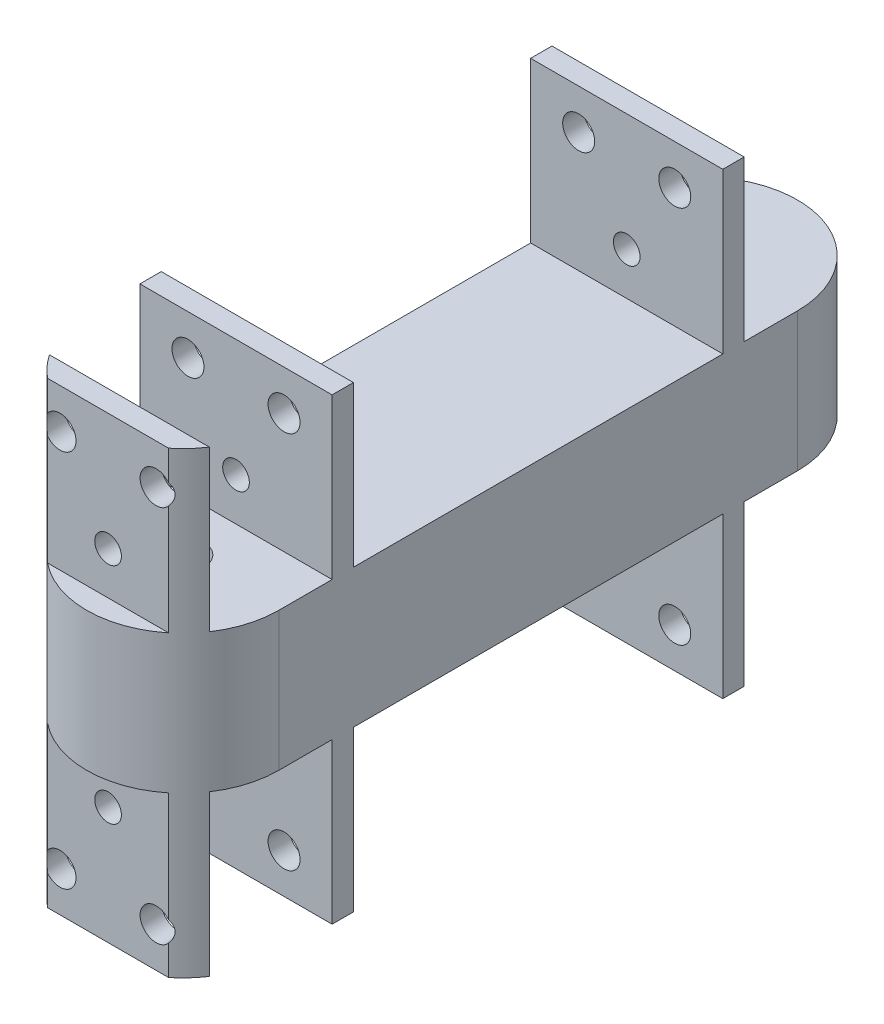
from build123d import *

# Parameters (mm, degrees)
SKETCH1_R                      = 4
BOSS_EXTRUDE1_DEPTH            = 3
BOSS_EXTRUDE3_DEPTH            = 20
BOSS_EXTRUDE4_START            = 30
SKETCH4_W                      = 36.05
SKETCH4_H                      = 4
BOSS_EXTRUDE4_DEPTH            = 30
CUT_EXTRUDE1_REACH             = 109.19
SKETCH5_R                      = 2.5
SKETCH5_R_2                    = 3
CUT_EXTRUDE1_DIRECTION_2_REACH = 109.19


with BuildPart() as part:
    # Sketch1 → Boss-Extrude1 (new body)
    with BuildSketch(Plane(origin=(0, 0, 0), x_dir=(1, 0, 0), z_dir=(0, 1, 0))):
        with BuildLine():
            Line((-18.025, 0), (-18.025, 97.29))
            ThreePointArc((-18.025, 97.29), (0, 115.315), (18.025, 97.29))
            Line((18.025, 97.29), (18.025, 0))
            ThreePointArc((18.025, 0), (0, -18.025), (-18.025, 0))
        make_face()
        Circle(SKETCH1_R, mode=Mode.SUBTRACT)
        with Locations((0, 97.29)):
            Circle(SKETCH1_R, mode=Mode.SUBTRACT)
    boss_extrude1 = extrude(amount=BOSS_EXTRUDE1_DEPTH)

    # Sketch3 → Boss-Extrude3 (add)
    with BuildSketch(Plane(origin=(0, 3, 0), x_dir=(1, 0, 0), z_dir=(0, 1, 0))):
        with BuildLine():
            Line((-15.025, 0), (-18.025, 0))
            ThreePointArc((-18.025, 0), (0, -18.025), (18.025, 0))
            Line((18.025, 0), (18.025, 97.29))
            ThreePointArc((18.025, 97.29), (12.745599731, 110.035599731), (0, 115.315))
            Line((0, 115.315), (0, 112.315))
            ThreePointArc((0, 112.315), (10.624279387, 107.914279387), (15.025, 97.29))
            Line((15.025, 97.29), (15.025, 0))
            ThreePointArc((15.025, 0), (0, -15.025), (-15.025, 0))
        make_face()
    extrude(amount=BOSS_EXTRUDE3_DEPTH)

    # Mirror1: Boss-Extrude1 across plane
    add(boss_extrude1.mirror(Plane.ZX.offset(13)))

    # Sketch4 → Boss-Extrude4 (add)
    with BuildSketch(Plane.XZ.offset(BOSS_EXTRUDE4_START)):
        with Locations((0, -12)):
            Rectangle(SKETCH4_W, SKETCH4_H)
        with BuildLine():
            Line((-14.996687134, 10), (14.996687134, 10))
            ThreePointArc((14.996687134, 10), (13.326001448, 12.137475454), (11.353441108, 14))
            Line((11.353441108, 14), (-11.353441108, 14))
            ThreePointArc((-11.353441108, 14), (-13.326001448, 12.137475454), (-14.996687134, 10))
        make_face()
        with Locations((0, -85.29)):
            Rectangle(SKETCH4_W, SKETCH4_H)
    boss_extrude4 = extrude(amount=-BOSS_EXTRUDE4_DEPTH)

    # Cut-Extrude1: up to this face of the body (flat: up to its plane)
    cut_extrude1_end = Plane(part.part.faces().sort_by_distance((0, -15, 14))[0])
    # Sketch5 → Cut-Extrude1 (cut, up to the picked face)
    with BuildSketch(Plane(origin=(0, 0, -14), x_dir=(-1, 0, 0), z_dir=(0, 0, -1)), mode=Mode.PRIVATE) as cut_extrude1_sk1:
        with Locations((0, -8)):
            Circle(SKETCH5_R)
    cut_extrude1_tool1 = split(extrude(cut_extrude1_sk1.sketch, amount=-CUT_EXTRUDE1_REACH, mode=Mode.PRIVATE), bisect_by=cut_extrude1_end, keep=Keep.BOTH, mode=Mode.PRIVATE)
    # Sketch5 → Cut-Extrude1 (cut, up to the picked face)
    with BuildSketch(Plane(origin=(0, 0, -14), x_dir=(-1, 0, 0), z_dir=(0, 0, -1)), mode=Mode.PRIVATE) as cut_extrude1_sk2:
        with Locations((-9.0125, -22.5)):
            Circle(SKETCH5_R_2)
    cut_extrude1_tool2 = split(extrude(cut_extrude1_sk2.sketch, amount=-CUT_EXTRUDE1_REACH, mode=Mode.PRIVATE), bisect_by=cut_extrude1_end, keep=Keep.BOTH, mode=Mode.PRIVATE)
    # Sketch5 → Cut-Extrude1 (cut, up to the picked face)
    with BuildSketch(Plane(origin=(0, 0, -14), x_dir=(-1, 0, 0), z_dir=(0, 0, -1)), mode=Mode.PRIVATE) as cut_extrude1_sk3:
        with Locations((9.0125, -22.5)):
            Circle(SKETCH5_R_2)
    cut_extrude1_tool3 = split(extrude(cut_extrude1_sk3.sketch, amount=-CUT_EXTRUDE1_REACH, mode=Mode.PRIVATE), bisect_by=cut_extrude1_end, keep=Keep.BOTH, mode=Mode.PRIVATE)
    cut_extrude1_1 = cut_extrude1_tool1.solids().sort_by(Axis((0, -8, -14), (0, 0, 1)))[0]
    add(cut_extrude1_1, mode=Mode.SUBTRACT)
    cut_extrude1_2 = cut_extrude1_tool2.solids().sort_by(Axis((9.0125, -22.5, -14), (0, 0, 1)))[0]
    add(cut_extrude1_2, mode=Mode.SUBTRACT)
    cut_extrude1_3 = cut_extrude1_tool3.solids().sort_by(Axis((-9.0125, -22.5, -14), (0, 0, 1)))[0]
    add(cut_extrude1_3, mode=Mode.SUBTRACT)
    cut_extrude1 = cut_extrude1_1 + cut_extrude1_2 + cut_extrude1_3  # Cut-Extrude1 as one shape, for the pattern or mirror that repeats it

    # Cut-Extrude1 direction 2: up to this face of the body (flat: up to its plane)
    cut_extrude1_direction_2_end = Plane(part.part.faces().sort_by_distance((0, -15, -87.29))[0])
    # Sketch5 → Cut-Extrude1 direction 2 (cut, up to the picked face)
    with BuildSketch(Plane(origin=(0, 0, -14), x_dir=(-1, 0, 0), z_dir=(0, 0, -1)), mode=Mode.PRIVATE) as cut_extrude1_direction_2_sk1:
        with Locations((0, -8)):
            Circle(SKETCH5_R)
    cut_extrude1_direction_2_tool1 = split(extrude(cut_extrude1_direction_2_sk1.sketch, amount=CUT_EXTRUDE1_DIRECTION_2_REACH, mode=Mode.PRIVATE), bisect_by=cut_extrude1_direction_2_end, keep=Keep.BOTH, mode=Mode.PRIVATE)
    # Sketch5 → Cut-Extrude1 direction 2 (cut, up to the picked face)
    with BuildSketch(Plane(origin=(0, 0, -14), x_dir=(-1, 0, 0), z_dir=(0, 0, -1)), mode=Mode.PRIVATE) as cut_extrude1_direction_2_sk2:
        with Locations((-9.0125, -22.5)):
            Circle(SKETCH5_R_2)
    cut_extrude1_direction_2_tool2 = split(extrude(cut_extrude1_direction_2_sk2.sketch, amount=CUT_EXTRUDE1_DIRECTION_2_REACH, mode=Mode.PRIVATE), bisect_by=cut_extrude1_direction_2_end, keep=Keep.BOTH, mode=Mode.PRIVATE)
    # Sketch5 → Cut-Extrude1 direction 2 (cut, up to the picked face)
    with BuildSketch(Plane(origin=(0, 0, -14), x_dir=(-1, 0, 0), z_dir=(0, 0, -1)), mode=Mode.PRIVATE) as cut_extrude1_direction_2_sk3:
        with Locations((9.0125, -22.5)):
            Circle(SKETCH5_R_2)
    cut_extrude1_direction_2_tool3 = split(extrude(cut_extrude1_direction_2_sk3.sketch, amount=CUT_EXTRUDE1_DIRECTION_2_REACH, mode=Mode.PRIVATE), bisect_by=cut_extrude1_direction_2_end, keep=Keep.BOTH, mode=Mode.PRIVATE)
    cut_extrude1_direction_2_1 = cut_extrude1_direction_2_tool1.solids().sort_by(Axis((0, -8, -14), (0, 0, -1)))[0]
    add(cut_extrude1_direction_2_1, mode=Mode.SUBTRACT)
    cut_extrude1_direction_2_2 = cut_extrude1_direction_2_tool2.solids().sort_by(Axis((9.0125, -22.5, -14), (0, 0, -1)))[0]
    add(cut_extrude1_direction_2_2, mode=Mode.SUBTRACT)
    cut_extrude1_direction_2_3 = cut_extrude1_direction_2_tool3.solids().sort_by(Axis((-9.0125, -22.5, -14), (0, 0, -1)))[0]
    add(cut_extrude1_direction_2_3, mode=Mode.SUBTRACT)
    cut_extrude1_direction_2 = cut_extrude1_direction_2_1 + cut_extrude1_direction_2_2 + cut_extrude1_direction_2_3  # Cut-Extrude1 direction 2 as one shape, for the pattern or mirror that repeats it

    # Mirror2: Boss-Extrude4, Cut-Extrude1, Cut-Extrude1 direction 2 across plane
    add(boss_extrude4.mirror(Plane.ZX.offset(13)))
    add(cut_extrude1.mirror(Plane.ZX.offset(13)), mode=Mode.SUBTRACT)
    add(cut_extrude1_direction_2.mirror(Plane.ZX.offset(13)), mode=Mode.SUBTRACT)


solid = part.part
